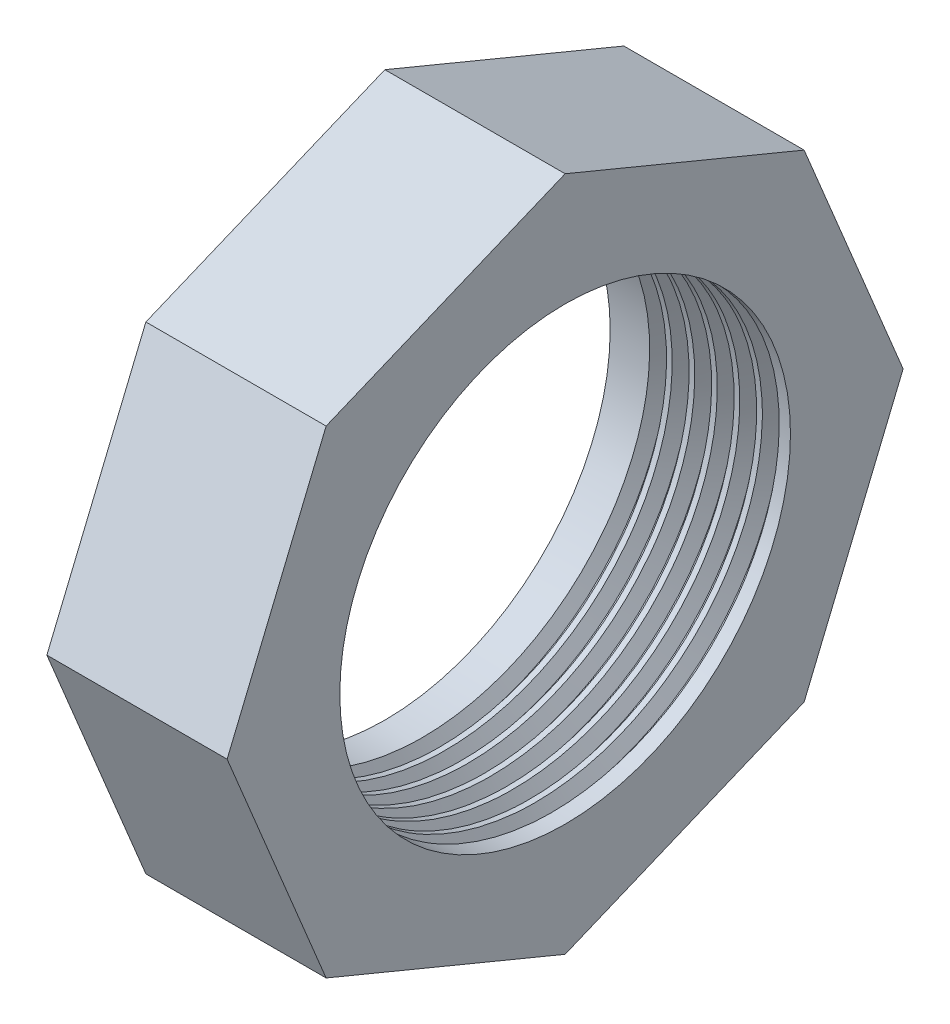
from build123d import *

# Parameters (mm, degrees)
SKETCH1_R           = 2.5
BOSS_EXTRUDE1_DEPTH = 2
THREAD1_PITCH       = 0.25


with BuildPart() as part:
    # Sketch1 → Boss-Extrude1 (new body)
    with BuildSketch(Plane(origin=(0, 0, 0), x_dir=(0, 0, -1), z_dir=(1, 0, 0))):
        Polygon((-2.651650429, 2.651650429), (0, 3.75), (2.651650429, 2.651650429), (3.75, 0), (2.651650429, -2.651650429), (0, -3.75), (-2.651650429, -2.651650429), (-3.75, 0), align=None)
        Circle(SKETCH1_R, mode=Mode.SUBTRACT)
    extrude(amount=BOSS_EXTRUDE1_DEPTH)

    # Thread1: the profile of Thread Profile1 profile screwed along a right-hand helix of 6 turns, 6 arcs to a turn; built about Z, then put on its axis
    thread1_z = Axis((0, 0, 0), (0, 0, 1))
    thread1_corners = [(2.4997, 0, -0.000173205), (2.635316469, 0, 0.078125), (2.635316469, 0, 0.109375), (2.4997, 0, 0.187673204)]
    with BuildLine(mode=Mode.PRIVATE) as thread1_profile:
        Line(thread1_corners[0], thread1_corners[1])
        Line(thread1_corners[1], thread1_corners[2])
        Line(thread1_corners[2], thread1_corners[3])
        Line(thread1_corners[3], thread1_corners[0])
    thread1_cap = Face(thread1_profile.wire())
    thread1_turn_angles = [0, 30, 60, 90, 120, 150, 180, 210, 240, 270, 300, 330, 360]
    thread1_turn_weights = [1, 0.8660254037844387, 1, 0.8660254037844387, 1, 0.8660254037844387, 1, 0.8660254037844387, 1, 0.8660254037844387, 1, 0.8660254037844387, 1]
    thread1_turn_rails = [Edge.make_bspline([Vector(p[0], p[1], 0).rotate(thread1_z, thread1_turn_angles[k]) / thread1_turn_weights[k] + Vector(0, 0, p[2] + THREAD1_PITCH * thread1_turn_angles[k] / 360) for k in range(13)], [0, 0, 0, 1, 1, 2, 2, 3, 3, 4, 4, 5, 5, 6, 6, 6], 2, thread1_turn_weights) for p in thread1_corners]
    thread1_turn_sides = [Face.make_surface_from_curves(thread1_turn_rails[p[0]], thread1_turn_rails[p[1]]) for p in [(0, 1), (1, 2), (2, 3), (3, 0)]]
    thread1 = Plane(origin=(2, 0, 0), x_dir=(0, 0, 1), z_dir=(-1, 0, 0)) * Solid(Shell([*[p.moved(Location((0, 0, THREAD1_PITCH * i))) for i in range(6) for p in thread1_turn_sides], thread1_cap, thread1_cap.rotate(thread1_z, 2160).moved(Location((0, 0, THREAD1_PITCH * 2160 / 360)))]))
    add(thread1, mode=Mode.SUBTRACT)


solid = part.part
